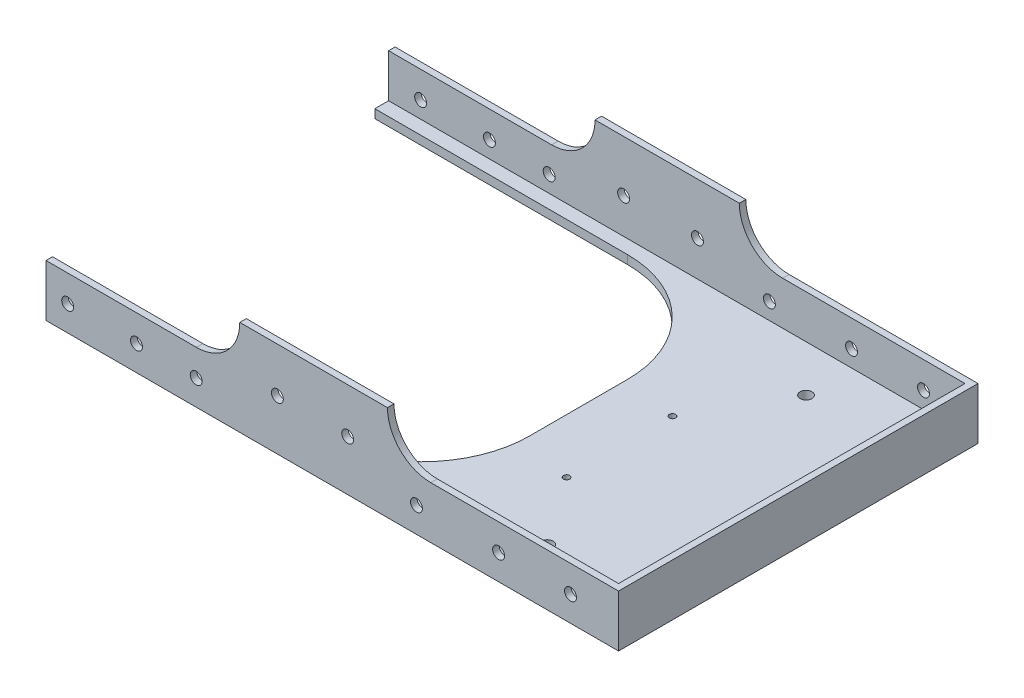
from build123d import *

# Parameters (mm, degrees)
SKETCH1_W              = 278.049859422
SKETCH1_H              = 166.000659628
BOSS_EXTRUDE1_DEPTH    = 24
SKETCH2_W              = 189.719631187
SKETCH2_H              = 145.09871859
CUT_EXTRUDE1_DEPTH     = 325.721331793
SKETCH3_W              = 272.049859422
SKETCH3_H              = 160.000659628
CUT_EXTRUDE2_DEPTH     = 20
FILLET1_R              = 50
FILLET2_R              = 50
SKETCH4_W              = 68.204970116
SKETCH4_H              = 3
BOSS_EXTRUDE2_DEPTH    = 20
FILLET4_R              = 20
FILLET5_R              = 20
SKETCH5_W              = 66.657615254
SKETCH5_H              = 3
BOSS_EXTRUDE3_DEPTH    = 20
FILLET6_R              = 20
FILLET7_R              = 20
SKETCH6_R              = 2.75
HOLESFORBOLTS1_DEPTH   = 326.295157302
SKETCH7_R              = 2.75
CUT_EXTRUDE4_DEPTH     = 327.808725896
SKETCH8_R              = 2.75
CUT_EXTRUDE5_DEPTH     = 20
SKETCH11_W             = 13.646136269
SKETCH11_H             = 11.541733762
CUT_EXTRUDE6_DEPTH     = 327.808725896
SKETCH12_W             = 8.844116654
SKETCH12_H             = 9.360207276
CUT_EXTRUDE7_DEPTH     = 327.808725896
HOLESINLIDFORPICOVER_R = 2.75
CUT_EXTRUDE8_DEPTH     = 107.252842694
LIDHOLESFORPI_R        = 1.455
CUT_EXTRUDE9_DEPTH     = 4
SKETCH14_R             = 2.75
CUT_EXTRUDE10_DEPTH    = 4


with BuildPart() as part:
    # Sketch1 → Boss-Extrude1 (new body)
    with BuildSketch(Plane(origin=(0, 0, 0), x_dir=(1, 0, 0), z_dir=(0, 1, 0))):
        with Locations((139.024929711, 83.000329814)):
            Rectangle(SKETCH1_W, SKETCH1_H)
    extrude(amount=BOSS_EXTRUDE1_DEPTH)

    # Sketch2 → Cut-Extrude1 (cut, through all)
    with BuildSketch(Plane(origin=(0, 0, 0), x_dir=(-1, 0, 0), z_dir=(0, -1, 0))):
        with Locations((-80.61962524, 84.091093057)):
            Rectangle(SKETCH2_W, SKETCH2_H)
    extrude(amount=-CUT_EXTRUDE1_DEPTH, mode=Mode.SUBTRACT)

    # Sketch3 → Cut-Extrude2 (cut)
    with BuildSketch(Plane(origin=(0, 24, 0), x_dir=(1, 0, 0), z_dir=(0, 1, 0))):
        with Locations((139.024929711, 83.000329814)):
            Rectangle(SKETCH3_W, SKETCH3_H)
    extrude(amount=-CUT_EXTRUDE2_DEPTH, mode=Mode.SUBTRACT)

    # Fillet1
    fillet1_edges = [part.edges().sort_by_distance(p)[0] for p in [
        (175.479440834, 2, -11.541733762),
    ]]
    fillet(fillet1_edges, radius=FILLET1_R)

    # Fillet2
    fillet2_edges = [part.edges().sort_by_distance(p)[0] for p in [
        (175.479440834, 2, -156.640452352),
    ]]
    fillet(fillet2_edges, radius=FILLET2_R)

    # Sketch4 → Boss-Extrude2 (add)
    with BuildSketch(Plane(origin=(0, 24, 0), x_dir=(1, 0, 0), z_dir=(0, 1, 0))):
        with Locations((137.24279725, 1.5)):
            Rectangle(SKETCH4_W, SKETCH4_H)
    extrude(amount=BOSS_EXTRUDE2_DEPTH)

    # Fillet4
    fillet4_edges = [part.edges().sort_by_distance(p)[0] for p in [
        (103.140312192, 24, -1.5),
    ]]
    fillet(fillet4_edges, radius=FILLET4_R - 0.0001)  # a hair under: the kernel refuses the full size

    # Fillet5
    fillet5_edges = [part.edges().sort_by_distance(p)[0] for p in [
        (171.345282308, 24, -1.5),
    ]]
    fillet(fillet5_edges, radius=FILLET5_R - 0.0001)  # a hair under: the kernel refuses the full size

    # Sketch5 → Boss-Extrude3 (add)
    with BuildSketch(Plane(origin=(0, 24, 0), x_dir=(1, 0, 0), z_dir=(0, 1, 0))):
        with Locations((137.51551703, 164.500659628)):
            Rectangle(SKETCH5_W, SKETCH5_H)
    extrude(amount=BOSS_EXTRUDE3_DEPTH)

    # Fillet6
    fillet6_edges = [part.edges().sort_by_distance(p)[0] for p in [
        (104.186709403, 24, -164.500659628),
    ]]
    fillet(fillet6_edges, radius=FILLET6_R - 0.0001)  # a hair under: the kernel refuses the full size

    # Fillet7
    fillet7_edges = [part.edges().sort_by_distance(p)[0] for p in [
        (170.844324657, 24, -164.500659628),
    ]]
    fillet(fillet7_edges, radius=FILLET7_R - 0.0001)  # a hair under: the kernel refuses the full size

    # Sketch6 → HolesForBolts1 (cut, through all)
    with BuildSketch(Plane.XY.offset(-163.000659628)):
        with Locations((151.506445743, 20.306027196)):
            Circle(SKETCH6_R)
        with Locations((117.392557181, 20.306027196)):
            Circle(SKETCH6_R)
    extrude(amount=-HOLESFORBOLTS1_DEPTH, mode=Mode.SUBTRACT)

    # Sketch7 → Cut-Extrude4 (cut, through all)
    with BuildSketch(Plane(origin=(0, 0, -166.000659628), x_dir=(-1, 0, 0), z_dir=(0, 0, -1))):
        with Locations((-23.654153003, 11.675842417)):
            Circle(SKETCH7_R)
        with Locations((-55.441477074, 11.675842417)):
            Circle(SKETCH7_R)
        with Locations((-83.004388954, 11.675842417)):
            Circle(SKETCH7_R)
        with Locations((-184.727610529, 11.675842417)):
            Circle(SKETCH7_R)
        with Locations((-222.645451091, 11.675842417)):
            Circle(SKETCH7_R)
        with Locations((-255.881733076, 11.675842417)):
            Circle(SKETCH7_R)
    extrude(amount=-CUT_EXTRUDE4_DEPTH, mode=Mode.SUBTRACT)

    # Sketch8 → Cut-Extrude5 (cut)
    with BuildSketch(Plane(origin=(0, 0, -3), x_dir=(-1, 0, 0), z_dir=(0, 0, -1))):
        with Locations((-120.487078085, 23.280365191)):
            Circle(SKETCH8_R)
        with Locations((-152.966291723, 23.280365191)):
            Circle(SKETCH8_R)
    extrude(amount=-CUT_EXTRUDE5_DEPTH, mode=Mode.SUBTRACT)

    # Sketch11 → Cut-Extrude6 (cut, through all)
    with BuildSketch(Plane.XZ):
        with Locations((6.823068135, -5.770866881)):
            Rectangle(SKETCH11_W, SKETCH11_H)
    extrude(amount=-CUT_EXTRUDE6_DEPTH, mode=Mode.SUBTRACT)

    # Sketch12 → Cut-Extrude7 (cut, through all)
    with BuildSketch(Plane.XZ):
        with Locations((4.422058327, -161.32055599)):
            Rectangle(SKETCH12_W, SKETCH12_H)
    extrude(amount=-CUT_EXTRUDE7_DEPTH, mode=Mode.SUBTRACT)

    # HolesInLidForPiCover → Cut-Extrude8 (cut)
    with BuildSketch(Plane.XZ):
        with Locations(Location((223.013799051, -141.608636884, 0), (0, 0, 270))):
            Circle(HOLESINLIDFORPICOVER_R)
        with Locations(Location((223.013799051, -22.129735073, 0), (0, 0, 270))):
            Circle(HOLESINLIDFORPICOVER_R)
    extrude(amount=-CUT_EXTRUDE8_DEPTH, mode=Mode.SUBTRACT)

    # LidHolesForPi → Cut-Extrude9 (cut)
    with BuildSketch(Plane.XZ):
        with Locations(Location((200.562123112, -102.370703816, 0), (0, 0, 270))):
            Circle(LIDHOLESFORPI_R)
        with Locations(Location((200.562123112, -53.502923562, 0), (0, 0, 270))):
            Circle(LIDHOLESFORPI_R)
        with Locations(Location((258.544947711, -53.502923562, 0), (0, 0, 270))):
            Circle(LIDHOLESFORPI_R)
        with Locations(Location((258.544947711, -102.370703816, 0), (0, 0, 270))):
            Circle(LIDHOLESFORPI_R)
    extrude(amount=-CUT_EXTRUDE9_DEPTH, mode=Mode.SUBTRACT)

    # Sketch14 → Cut-Extrude10 (cut)
    with BuildSketch(Plane.XZ):
        with Locations(Location((264.763568483, -18.920123653, 0), (0, 0, 270))):
            Circle(SKETCH14_R)
        with Locations(Location((181.616848195, -18.918729826, 0), (0, 0, 270))):
            Circle(SKETCH14_R)
    extrude(amount=-CUT_EXTRUDE10_DEPTH, mode=Mode.SUBTRACT)


solid = part.part
